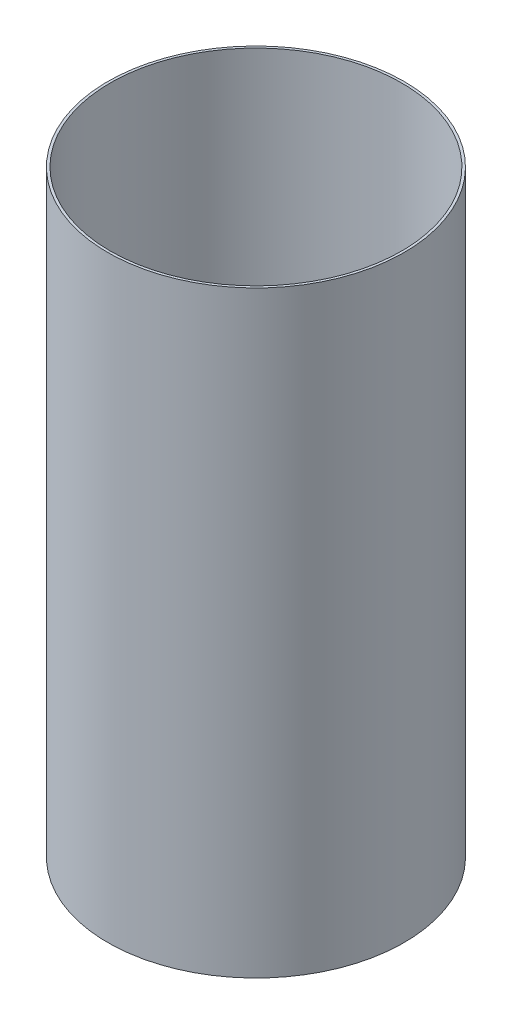
from build123d import *
from build123d.topology import SkipClean

# Parameters (mm, degrees)
SKETCH1_R           = 75.565
SKETCH1_R_2         = 74.295
EXTRUDE_THIN2_DEPTH = 304.8
SKETCH3_R           = 3.302
CUT_EXTRUDE2_DEPTH  = 2.54
CIRPATTERN2_COUNT   = 3


with BuildPart() as part:
    # Sketch1 → Extrude-Thin2 (new body)
    with BuildSketch(Plane(origin=(0, 0, 0), x_dir=(1, 0, 0), z_dir=(0, 1, 0))):
        Circle(SKETCH1_R)
        Circle(SKETCH1_R_2, mode=Mode.SUBTRACT)
    extrude(amount=EXTRUDE_THIN2_DEPTH)

    # Sketch3 → Cut-Extrude2 (cut)
    with SkipClean():  # the faces are left unmerged after this step: merging them gives an invalid solid
        with BuildSketch(Plane.ZY.offset(-74.295)):
            with Locations((0, 63.5)):
                Circle(SKETCH3_R)
        cut_extrude2 = extrude(amount=CUT_EXTRUDE2_DEPTH, mode=Mode.SUBTRACT)

    # CirPattern2: Cut-Extrude2 ×3 about axis
    with SkipClean():  # the faces are left unmerged after this step: merging them gives an invalid solid
        cirpattern2_axis = Axis((0, 320.36932057, 0), (0, -1, 0))
        for i in range(1, CIRPATTERN2_COUNT):
            add(cut_extrude2.rotate(cirpattern2_axis, i * 360 / CIRPATTERN2_COUNT), mode=Mode.SUBTRACT)


solid = part.part
